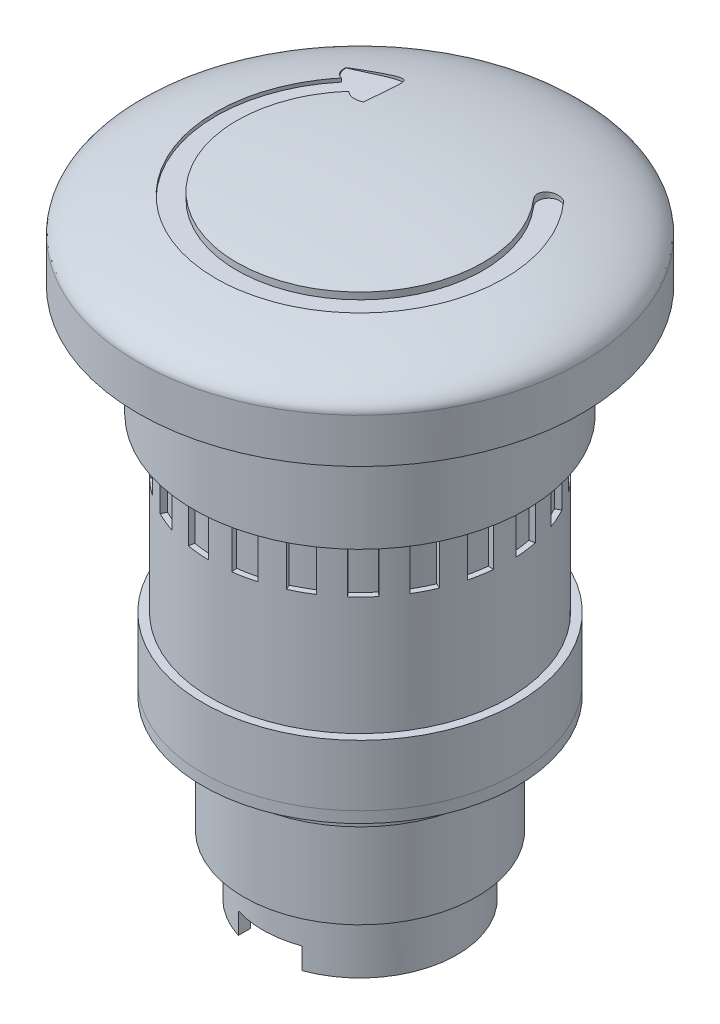
from build123d import *

# Parameters (mm, degrees)
SKETCH1_R               = 20
BOSS_EXTRUDE1_DEPTH     = 8
FILLET1_SIZE            = 4
FILLET1_SIZE_2          = 19.99
SKETCH2_R               = 15
BOSS_EXTRUDE2_DEPTH     = 10
SKETCH3_R               = 13.425
BOSS_EXTRUDE3_DEPTH     = 21
SKETCH4_R               = 14.17
BOSS_EXTRUDE4_DEPTH     = 5.5
WRAP1_START             = -14.836751175
WRAP1_DEPTH             = 4.5
SKETCH6_R               = 14.17
BOSS_EXTRUDE5_DEPTH     = 1
SKETCH7_R               = 11
BOSS_EXTRUDE6_DEPTH     = 2.5
SKETCH8_R               = 10.5
BOSS_EXTRUDE7_DEPTH     = 8
SKETCH9_R               = 8.75
BOSS_EXTRUDE8_DEPTH     = 5.39
CUT_EXTRUDE1_DEPTH      = 5.39
SKETCH11_R              = 7.72
CUT_EXTRUDE2_DEPTH      = 5
SKETCH12_R              = 7.72
BOSS_EXTRUDE9_DEPTH     = 1
CUT_EXTRUDE3_REACH      = 61.33
CUT_EXTRUDE3_END_RADIUS = 7.72
SKETCH13_W              = 5.606598346
SKETCH13_H              = 2.351154146


# Read off the part's stored shape, not the designer's step: Wrap1
with BuildPart() as part:
    # Sketch1 → Boss-Extrude1 (new body)
    with BuildSketch(Plane(origin=(0, 0, 0), x_dir=(1, 0, 0), z_dir=(0, 1, 0))):
        with Locations(Location((0, 0, 0), (0, 0, 270))):
            Circle(SKETCH1_R)
    extrude(amount=BOSS_EXTRUDE1_DEPTH)

    # Fillet1
    # an asymmetric fillet: 19.99, 4 mm, written as the material it takes off along each edge
    with BuildSketch(Plane(origin=(0, 8, 0), x_dir=(0, 0, 1), z_dir=(-1, 0, 0))) as fillet1_piece_1:
        with BuildLine():
            Bezier((20, -FILLET1_SIZE), (20, 0), (20 - FILLET1_SIZE_2, 0), weights=[1, 0.707106781, 1])
            Line((20 - FILLET1_SIZE_2, 0), (20, 0))
            Line((20, 0), (20, -FILLET1_SIZE))
        make_face()
    revolve(axis=Axis((0, 8, 0), (0, 1, 0)), mode=Mode.SUBTRACT)

    # Sketch2 → Boss-Extrude2 (add)
    with BuildSketch(Plane(origin=(0, 0, 0), x_dir=(-1, 0, 0), z_dir=(0, -1, 0))):
        with Locations(Location((0, 0, 0), (0, 0, 90))):
            Circle(SKETCH2_R)
    extrude(amount=BOSS_EXTRUDE2_DEPTH)

    # Sketch3 → Boss-Extrude3 (add)
    with BuildSketch(Plane(origin=(0, -10, 0), x_dir=(-1, 0, 0), z_dir=(0, -1, 0))):
        with Locations(Location((0, 0, 0), (0, 0, 270))):
            Circle(SKETCH3_R)
    extrude(amount=BOSS_EXTRUDE3_DEPTH)

    # Sketch4 → Boss-Extrude4 (add)
    with BuildSketch(Plane.XZ.offset(31)):
        with Locations(Location((0, 0, 0), (0, 0, 270))):
            Circle(SKETCH4_R)
    extrude(amount=-BOSS_EXTRUDE4_DEPTH)

    # Wrap1 outline → Wrap1 (cut)
    with BuildSketch(Plane(origin=(0, 0, 0), x_dir=(1, 0, 0), z_dir=(0, 1, 0)).offset(WRAP1_START)):
        with BuildLine():
            ThreePointArc((4.009925363, 12.812147501), (3.045338452, 13.075034941), (2.063862455, 13.265409785))
            Line((2.063862455, 13.265409785), (1.986996069, 12.771353555))
            ThreePointArc((1.986996069, 12.771353555), (2.931918026, 12.588069022), (3.860579912, 12.334972547))
            Line((3.860579912, 12.334972547), (4.009925363, 12.812147501))
        make_face()
        with BuildLine():
            Line((0.06939476, 12.924813707), (0.072079276, 13.424806501))
            ThreePointArc((0.072079276, 13.424806501), (-0.927181711, 13.392944377), (-1.921300657, 13.286806568))
            Line((-1.921300657, 13.286806568), (-1.849743836, 12.791953437))
            ThreePointArc((-1.849743836, 12.791953437), (-0.892649803, 12.894138255), (0.06939476, 12.924813707))
        make_face()
        with BuildLine():
            ThreePointArc((7.881844881, 10.867711179), (7.051224437, 11.424134932), (6.181498736, 11.917201785))
            Line((6.181498736, 11.917201785), (5.951275319, 11.473358143))
            ThreePointArc((5.951275319, 11.473358143), (6.788609001, 10.998655046), (7.588293861, 10.462954711))
            Line((7.588293861, 10.462954711), (7.881844881, 10.867711179))
        make_face()
        with BuildLine():
            Line((-3.727905482, 12.375715968), (-3.87211846, 12.854467069))
            ThreePointArc((-3.87211846, 12.854467069), (-4.817998311, 12.530663082), (-5.737158114, 12.13736552))
            Line((-5.737158114, 12.13736552), (-5.523483696, 11.685322112))
            ThreePointArc((-5.523483696, 11.685322112), (-4.638557033, 12.063971719), (-3.727905482, 12.375715968))
        make_face()
        with BuildLine():
            ThreePointArc((10.724923686, 8.075062658), (10.094245754, 8.850809435), (9.40758633, 9.57747067))
            Line((9.40758633, 9.57747067), (9.057210675, 9.220767852))
            ThreePointArc((9.057210675, 9.220767852), (9.718296191, 8.52117035), (10.325485187, 7.774315446))
            Line((10.325485187, 7.774315446), (10.724923686, 8.075062658))
        make_face()
        with BuildLine():
            Line((-7.196701448, 10.736066005), (-7.475103825, 11.151387708))
            ThreePointArc((-7.475103825, 11.151387708), (-8.284251292, 10.564175573), (-9.047455282, 9.91837577))
            Line((-9.047455282, 9.91837577), (-8.710492329, 9.5489763))
            ThreePointArc((-8.710492329, 9.5489763), (-7.975713069, 10.170723968), (-7.196701448, 10.736066005))
        make_face()
        with BuildLine():
            ThreePointArc((12.622918634, 4.57083692), (12.247758765, 5.497547656), (11.804674276, 6.393769643))
            Line((11.804674276, 6.393769643), (11.365021603, 6.155640419))
            ThreePointArc((11.365021603, 6.155640419), (11.791603877, 5.292797277), (12.152791311, 4.400600908))
            Line((12.152791311, 4.400600908), (12.622918634, 4.57083692))
        make_face()
        with BuildLine():
            Line((-10.031321679, 8.150350322), (-10.419380545, 8.465644338))
            ThreePointArc((-10.419380545, 8.465644338), (-11.020493283, 7.666769385), (-11.56048767, 6.825375436))
            Line((-11.56048767, 6.825375436), (-11.12992947, 6.571171509))
            ThreePointArc((-11.12992947, 6.571171509), (-10.610046606, 7.381228626), (-10.031321679, 8.150350322))
        make_face()
        with BuildLine():
            ThreePointArc((13.408577779, 0.663827506), (13.321995185, 1.659840141), (13.161530383, 2.646647499))
            Line((13.161530383, 2.646647499), (12.671343031, 2.548075898))
            ThreePointArc((12.671343031, 2.548075898), (12.825831491, 1.598021142), (12.909189407, 0.639103949))
            Line((12.909189407, 0.639103949), (13.408577779, 0.663827506))
        make_face()
        with BuildLine():
            Line((-11.981978495, 4.846423046), (-12.445497973, 5.033905563))
            ThreePointArc((-12.445497973, 5.033905563), (-12.785605726, 4.093764919), (-13.054806024, 3.130920739))
            Line((-13.054806024, 3.130920739), (-12.568593509, 3.01431289))
            ThreePointArc((-12.568593509, 3.01431289), (-12.309419293, 3.941296951), (-11.981978495, 4.846423046))
        make_face()
        with BuildLine():
            ThreePointArc((13.012668572, -3.30167861), (13.222292941, -2.324133041), (13.358588038, -1.333698105))
            Line((13.358588038, -1.333698105), (12.861061481, -1.284025923))
            ThreePointArc((12.861061481, -1.284025923), (12.729842552, -2.237573151), (12.528025422, -3.178711064))
            Line((12.528025422, -3.178711064), (13.012668572, -3.30167861))
        make_face()
        with BuildLine():
            Line((-12.876779365, 1.115427354), (-13.374913963, 1.158577348))
            ThreePointArc((-13.374913963, 1.158577348), (-13.424046324, 0.160016521), (-13.398730513, -0.839431739))
            Line((-13.398730513, -0.839431739), (-12.899708892, -0.808167987))
            ThreePointArc((-12.899708892, -0.808167987), (-12.924081843, 0.154056874), (-12.876779365, 1.115427354))
        make_face()
        with BuildLine():
            ThreePointArc((11.470078666, -6.976239704), (11.957437828, -6.103302843), (12.378482455, -5.196517788))
            Line((12.378482455, -5.196517788), (11.9174589, -5.00297895))
            ThreePointArc((11.9174589, -5.00297895), (11.512095637, -5.87599175), (11.042887654, -6.716416996))
            Line((11.042887654, -6.716416996), (11.470078666, -6.976239704))
        make_face()
        with BuildLine():
            Line((-12.636874138, -2.713860169), (-13.12572807, -2.818845089))
            ThreePointArc((-13.12572807, -2.818845089), (-12.879555478, -3.787832586), (-12.561954395, -4.735813212))
            Line((-12.561954395, -4.735813212), (-12.09409762, -4.559432832))
            ThreePointArc((-12.09409762, -4.559432832), (-12.399869985, -3.646758747), (-12.636874138, -2.713860169))
        make_face()
        with BuildLine():
            ThreePointArc((8.916741598, -10.036052226), (9.638889301, -9.344647561), (10.307580865, -8.601418588))
            Line((10.307580865, -8.601418588), (9.92368586, -8.281067802))
            ThreePointArc((9.92368586, -8.281067802), (9.27989901, -8.996615995), (8.584646939, -9.66227002))
            Line((8.584646939, -9.66227002), (8.916741598, -10.036052226))
        make_face()
        with BuildLine():
            Line((-11.283403343, -6.304001428), (-11.719898636, -6.547869955))
            ThreePointArc((-11.719898636, -6.547869955), (-11.200113902, -7.40189662), (-10.618214662, -8.214873243))
            Line((-10.618214662, -8.214873243), (-10.222750428, -7.908918932))
            ThreePointArc((-10.222750428, -7.908918932), (-10.782977444, -7.126220769), (-11.283403343, -6.304001428))
        make_face()
        with BuildLine():
            ThreePointArc((5.577658283, -12.211484475), (6.47095863, -11.762538816), (7.328371807, -11.248359509))
            Line((7.328371807, -11.248359509), (7.05543431, -10.829426194))
            ThreePointArc((7.05543431, -10.829426194), (6.229954585, -11.324455434), (5.369924269, -11.756680584))
            Line((5.369924269, -11.756680584), (5.577658283, -12.211484475))
        make_face()
        with BuildLine():
            Line((-8.935635277, -9.338631976), (-9.281307822, -9.699894335))
            ThreePointArc((-9.281307822, -9.699894335), (-8.53371455, -10.363703053), (-7.738794307, -10.970035901))
            Line((-7.738794307, -10.970035901), (-7.450571055, -10.561468456))
            ThreePointArc((-7.450571055, -10.561468456), (-8.21588533, -9.977717837), (-8.935635277, -9.338631976))
        make_face()
        with BuildLine():
            ThreePointArc((1.747069858, -13.310836635), (2.732804925, -13.143911223), (3.703384179, -12.904091236))
            Line((3.703384179, -12.904091236), (3.565455532, -12.423491935))
            ThreePointArc((3.565455532, -12.423491935), (2.631024481, -12.654380079), (1.68200208, -12.815088529))
            Line((1.68200208, -12.815088529), (1.747069858, -13.310836635))
        make_face()
        with BuildLine():
            Line((-5.800456048, -11.550339157), (-6.024845063, -11.997160788))
            ThreePointArc((-6.024845063, -11.997160788), (-5.115321422, -12.412256513), (-4.177428814, -12.758515333))
            Line((-4.177428814, -12.758515333), (-4.021844873, -12.283337853))
            ThreePointArc((-4.021844873, -12.283337853), (-4.924806658, -11.949975079), (-5.800456048, -11.550339157))
        make_face()
        with BuildLine():
            ThreePointArc((-2.237470946, -13.237233426), (-1.246164463, -13.367037784), (-0.247946899, -13.422710134))
            Line((-0.247946899, -13.422710134), (-0.238712378, -12.922795417))
            ThreePointArc((-0.238712378, -12.922795417), (-1.199752379, -12.869196526), (-2.154138695, -12.744226594))
            Line((-2.154138695, -12.744226594), (-2.237470946, -13.237233426))
        make_face()
    extrude(amount=WRAP1_DEPTH, mode=Mode.SUBTRACT)

    # Sketch10 → Cut-Extrude1 (cut)
    with BuildSketch(Plane(origin=(0, 12.11, 0), x_dir=(-1, 0, 0), z_dir=(0, -1, 0))):
        with BuildLine():
            ThreePointArc((8.320773362, 7.344233283), (0.041043667, -11.09825875), (-8.374866022, 7.282489338))
            ThreePointArc((-8.374866022, 7.282489338), (-8.384737693, 8.559402113), (-9.653089579, 8.707345266))
            ThreePointArc((-9.653089579, 8.707345266), (-0.260730861, -12.997385099), (9.994526241, 8.313209081))
            ThreePointArc((9.994526241, 8.313209081), (10.640804975, 8.833466686), (10.884079009, 9.626663965))
            add(Edge.make_bspline(
                [(10.884079009, 9.626663965), (8.472154383, 10.767357713), (6.83867545, 11.440406787), (6.703840833, 10.607835887), (6.65797048, 6.974371816)],
                knots=[0, 0, 0, 0, 0.486884743, 1, 1, 1, 1], degree=3))
            ThreePointArc((6.65797048, 6.974371816), (7.549833995, 6.887480474), (8.320773362, 7.344233283))
        make_face()
    extrude(amount=CUT_EXTRUDE1_DEPTH, mode=Mode.SUBTRACT)


with BuildPart() as body_2:
    # Sketch6 → Boss-Extrude5 (new body)
    with BuildSketch(Plane.XZ.offset(31)):
        with Locations(Location((0, 0, 0), (0, 0, 270))):
            Circle(SKETCH6_R)
    extrude(amount=BOSS_EXTRUDE5_DEPTH)

    # Sketch7 → Boss-Extrude6 (add)
    with BuildSketch(Plane(origin=(0, -32, 0), x_dir=(-1, 0, 0), z_dir=(0, -1, 0))):
        with Locations(Location((0, 0, 0), (0, 0, 90))):
            Circle(SKETCH7_R)
    extrude(amount=BOSS_EXTRUDE6_DEPTH)

    # Sketch8 → Boss-Extrude7 (add)
    with BuildSketch(Plane.XZ.offset(34.5)):
        with Locations(Location((0, 0, 0), (0, 0, 270))):
            Circle(SKETCH8_R)
    extrude(amount=BOSS_EXTRUDE7_DEPTH)

    # Sketch9 → Boss-Extrude8 (add)
    with BuildSketch(Plane.XZ.offset(42.5)):
        with Locations(Location((0, 0, 0), (0, 0, 270))):
            Circle(SKETCH9_R)
    extrude(amount=BOSS_EXTRUDE8_DEPTH)

    # Sketch11 → Cut-Extrude2 (cut)
    with BuildSketch(Plane(origin=(0, -47.89, 0), x_dir=(-1, 0, 0), z_dir=(0, -1, 0))):
        with Locations(Location((0, 0, 0), (0, 0, 90))):
            Circle(SKETCH11_R)
    extrude(amount=-CUT_EXTRUDE2_DEPTH, mode=Mode.SUBTRACT)

    # Cut-Extrude3: up to this cylinder (the profile starts outside it)
    cut_extrude3_end = Plane(origin=(0, -47.142811, 0), z_dir=(0, -1, 0)) * Cylinder(CUT_EXTRUDE3_END_RADIUS, 139.1, mode=Mode.PRIVATE)
    # Sketch13 → Cut-Extrude3 (cut, up to the surface)
    with BuildSketch(Plane.XY.offset(8.75), mode=Mode.PRIVATE) as cut_extrude3_sk1:
        with Locations((0.179741982, -47.142811208)):
            Rectangle(SKETCH13_W, SKETCH13_H)
    cut_extrude3_tool1 = extrude(cut_extrude3_sk1.sketch, amount=-CUT_EXTRUDE3_REACH, mode=Mode.PRIVATE) - cut_extrude3_end
    add(cut_extrude3_tool1.solids().sort_by_distance((0.179742, -47.142811, 8.75))[0], mode=Mode.SUBTRACT)


with BuildPart() as body_3:
    # Sketch12 → Boss-Extrude9 (new body)
    with BuildSketch(Plane(origin=(0, -42.89, 0), x_dir=(-1, 0, 0), z_dir=(0, -1, 0))):
        with Locations(Location((0, 0, 0), (0, 0, 90))):
            Circle(SKETCH12_R)
    extrude(amount=BOSS_EXTRUDE9_DEPTH)


solid = Compound([part.part, body_2.part, body_3.part])
